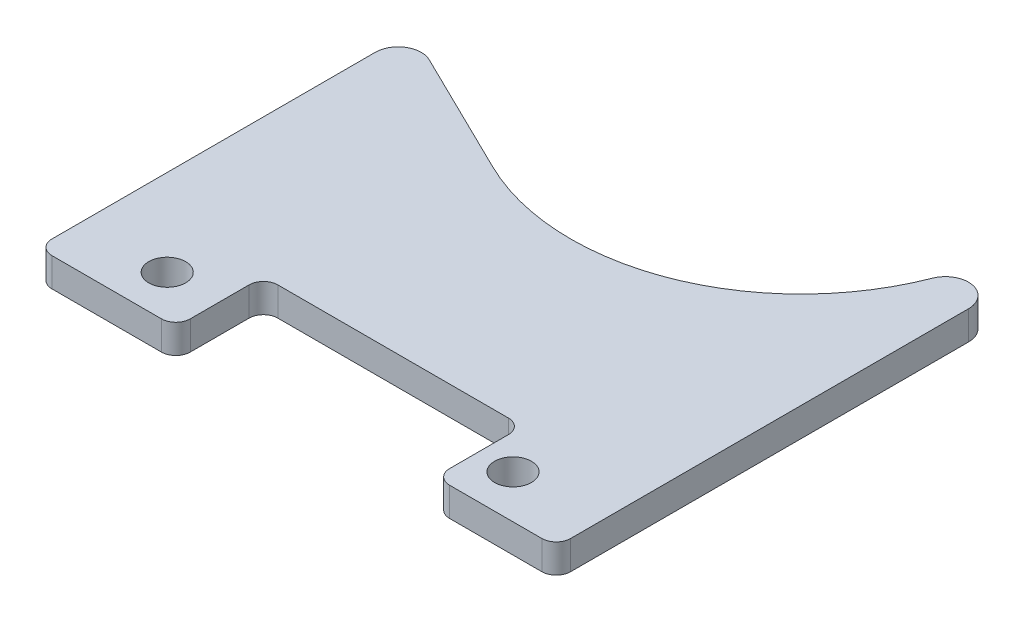
from build123d import *

# Parameters (mm, degrees)
SKETCH1_W           = 57.15
SKETCH1_H           = 60.325
BOSS_EXTRUDE1_DEPTH = 3.175
SKETCH2_R           = 2.032
CUT_EXTRUDE1_DEPTH  = 42.669985076
SKETCH3_W           = 28.575
SKETCH3_H           = 9.652
CUT_EXTRUDE2_DEPTH  = 42.669985076
FILLET1_R           = 1.5875
CUT_EXTRUDE4_DEPTH  = 42.669985076
FILLET2_R           = 2.54


with BuildPart() as part:
    # Sketch1 → Boss-Extrude1 (new body)
    with BuildSketch(Plane(origin=(0, 0, 0), x_dir=(1, 0, 0), z_dir=(0, 1, 0))):
        Rectangle(SKETCH1_W, SKETCH1_H)
    extrude(amount=BOSS_EXTRUDE1_DEPTH)

    # Sketch2 → Cut-Extrude1 (cut, through all)
    with BuildSketch(Plane(origin=(0, 0, 0), x_dir=(-1, 0, 0), z_dir=(0, -1, 0))):
        with Locations((-19.05, -25.4)):
            Circle(SKETCH2_R)
        with Locations((19.05, -25.4)):
            Circle(SKETCH2_R)
    extrude(amount=-CUT_EXTRUDE1_DEPTH, mode=Mode.SUBTRACT)

    # Sketch3 → Cut-Extrude2 (cut, through all)
    with BuildSketch(Plane(origin=(0, 3.175, 0), x_dir=(1, 0, 0), z_dir=(0, 1, 0))):
        with Locations((0.9525, -25.3365)):
            Rectangle(SKETCH3_W, SKETCH3_H)
    extrude(amount=-CUT_EXTRUDE2_DEPTH, mode=Mode.SUBTRACT)

    # Fillet1
    fillet1_edges = [part.edges().sort_by_distance(p)[0] for p in [
        (-28.575, 1.5875, 30.1625),
        (-13.335, 1.5875, 30.1625),
        (-13.335, 1.5875, 20.5105),
        (15.24, 1.5875, 20.5105),
        (15.24, 1.5875, 30.1625),
        (28.575, 1.5875, 30.1625),
    ]]
    fillet(fillet1_edges, radius=FILLET1_R)

    # Sketch5 → Cut-Extrude4 (cut, through all)
    with BuildSketch(Plane(origin=(0, 3.175, 0), x_dir=(1, 0, 0), z_dir=(0, 1, 0))):
        with BuildLine():
            Line((-11.172299719, 2.589043883), (-28.575, 11.1125))
            Line((-28.575, 11.1125), (-28.575, 30.1625))
            Line((-28.575, 30.1625), (28.575, 30.1625))
            Line((28.575, 30.1625), (23.975532391, 17.013472319))
            ThreePointArc((23.975532391, 17.013472319), (9.643480992, 1.901845299), (-11.172299719, 2.589043883))
        make_face()
    extrude(amount=-CUT_EXTRUDE4_DEPTH, mode=Mode.SUBTRACT)

    # Fillet2
    fillet2_edges = [part.edges().sort_by_distance(p)[0] for p in [
        (28.575, 1.5875, -30.1625),
        (-28.575, 1.5875, -11.1125),
    ]]
    fillet(fillet2_edges, radius=FILLET2_R)


solid = part.part
